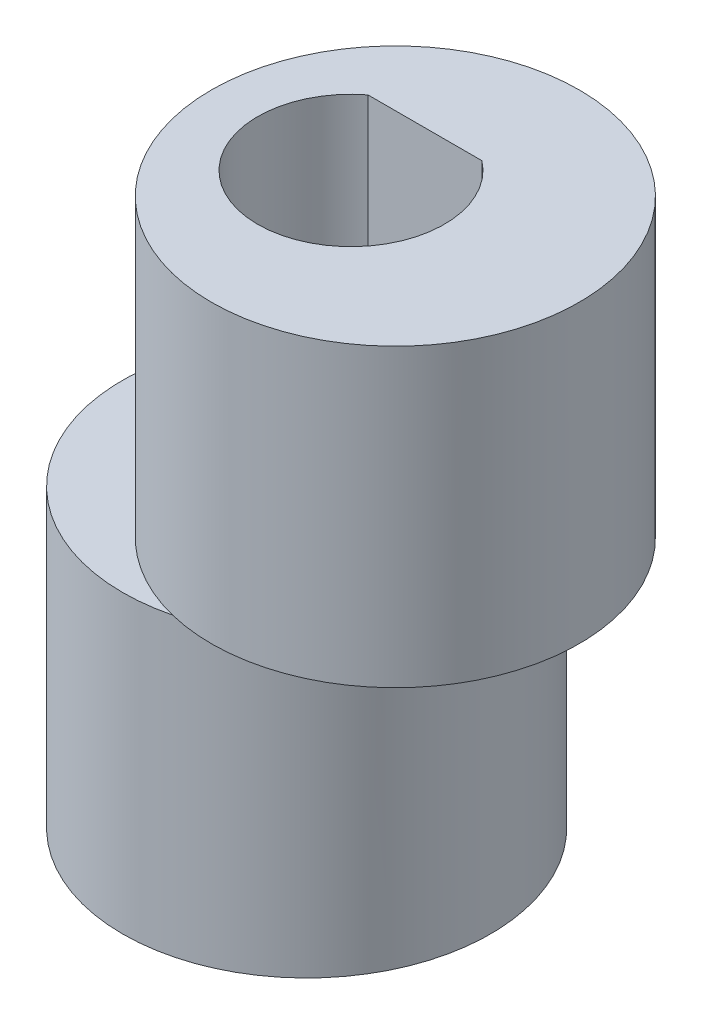
from build123d import *

# Parameters (mm, degrees)
SKETCH1_R               = 4.975
BOSS_EXTRUDE1_DEPTH     = 8
SKETCH2_R               = 4.975
BOSS_EXTRUDE2_DEPTH     = 8
CUT_EXTRUDE1_DEPTH      = 8
CUT_EXTRUDE1_DEPTH_BACK = 8
SKETCH1_4_R             = 2.525
BOSS_EXTRUDE3_START     = -10
BOSS_EXTRUDE3_DEPTH     = 10


with BuildPart() as part:
    # Sketch1 → Boss-Extrude1 (new body)
    with BuildSketch(Plane(origin=(0, 0, 0), x_dir=(1, 0, 0), z_dir=(0, 1, 0))):
        Circle(SKETCH1_R)
    extrude(amount=BOSS_EXTRUDE1_DEPTH)

    # Sketch2 → Boss-Extrude2 (add)
    with BuildSketch(Plane(origin=(0, 0, 0), x_dir=(1, 0, 0), z_dir=(0, 1, 0))):
        with Locations((-2.4, 0)):
            Circle(SKETCH2_R)
    extrude(amount=-BOSS_EXTRUDE2_DEPTH)

    # Sketch1<4> → Cut-Extrude1 (cut, two sides: drawn at the far end of the back side and taken through both)
    with BuildSketch(Plane(origin=(0, 0, 0), x_dir=(1, 0, 0), z_dir=(0, 1, 0)).offset(-CUT_EXTRUDE1_DEPTH_BACK)):
        with Locations((-1.2, 0)):
            Circle(SKETCH1_4_R)
    extrude(amount=CUT_EXTRUDE1_DEPTH + CUT_EXTRUDE1_DEPTH_BACK, mode=Mode.SUBTRACT)

    # Sketch3 → Boss-Extrude3 (add)
    with BuildSketch(Plane(origin=(0, 8, 0), x_dir=(1, 0, 0), z_dir=(0, 1, 0)).offset(BOSS_EXTRUDE3_START)):
        with BuildLine():
            Line((-2.741306264, 2), (0.341306264, 2))
            ThreePointArc((0.341306264, 2), (-1.2, 2.525), (-2.741306264, 2))
        make_face()
    extrude(amount=BOSS_EXTRUDE3_DEPTH)


solid = part.part
